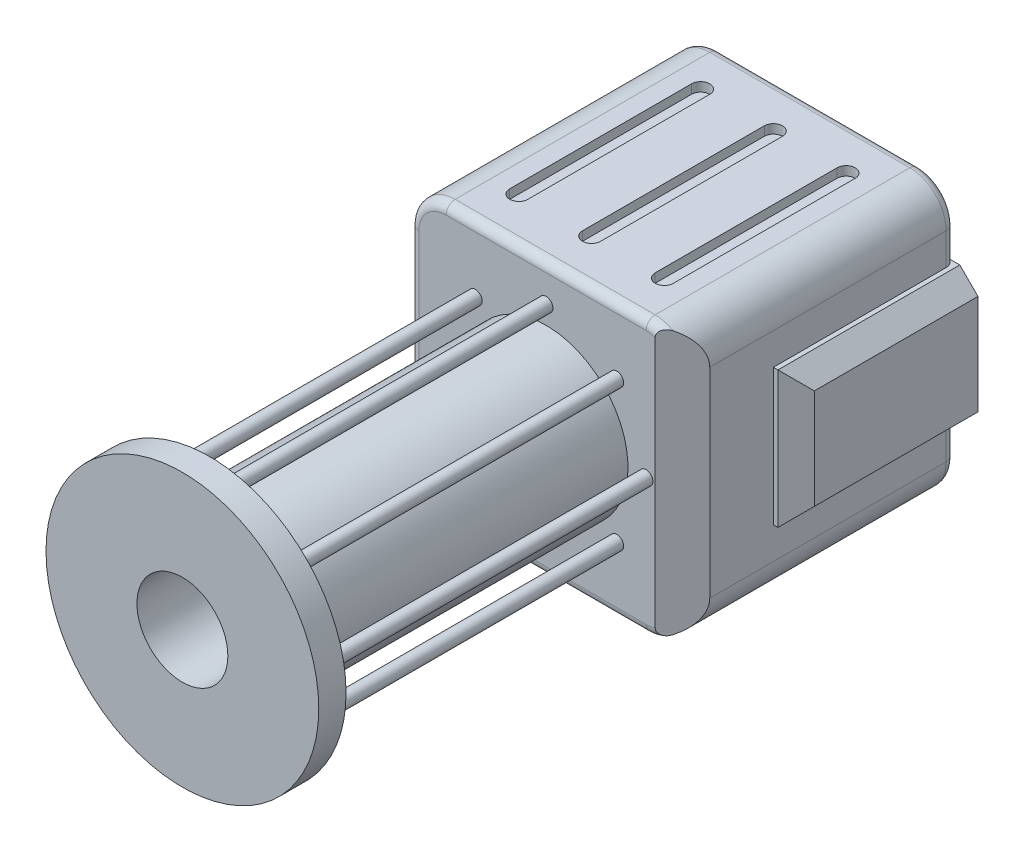
from build123d import *

# Parameters (mm, degrees)
SKETCH1_W           = 30
SKETCH1_H           = 30
BOSS_EXTRUDE1_DEPTH = 15
FILLET1_R           = 4
CHAMFER2_SIZE       = 3
FILLET2_R           = 1
SKETCH3_R           = 10
BOSS_EXTRUDE2_DEPTH = 5
FILLET3_R           = 5
SKETCH4_W           = 5
SKETCH4_H           = 15
BOSS_EXTRUDE3_DEPTH = 20
CHAMFER3_SIZE       = 2
SKETCH5_R           = 5
CUT_EXTRUDE1_DEPTH  = 10
SKETCH6_R           = 0.75
BOSS_EXTRUDE5_DEPTH = 40
CIRPATTERN2_COUNT   = 8
SKETCH7_R           = 5
CUT_EXTRUDE2_DEPTH  = 10
CUT_EXTRUDE3_DEPTH  = 1
LPATTERN1_COUNT     = 2
LPATTERN1_PITCH     = 8
LPATTERN1_COL_COUNT = 2
LPATTERN1_COL_PITCH = 8


# Some blends are built 0.0001 mm under size
with BuildPart() as part:
    # Sketch1 → Boss-Extrude1 (new, symmetric)
    with BuildSketch(Plane.XY):
        Rectangle(SKETCH1_W, SKETCH1_H)
    extrude(amount=BOSS_EXTRUDE1_DEPTH, both=True)

    # Sketch2 → Revolve1 (revolve)
    with BuildSketch(Plane(origin=(0, 0, 0), x_dir=(0, 0, -1), z_dir=(1, 0, 0)), mode=Mode.PRIVATE) as revolve1_sk:
        Polygon((-55, 0), (-55, 15), (-52, 15), (-52, 9), (-15, 9), (-15, 0), align=None)
    revolve(revolve1_sk.sketch.rotate(Axis((0, 0, 15), (0, 0, 1)), 90), axis=Axis((0, 0, 15), (0, 0, 1)))

    # Fillet1
    fillet1_edges = [part.edges().sort_by_distance(p)[0] for p in [
        (15, -15, 0),
        (-15, -15, 0),
        (-15, 15, 0),
        (15, 15, 0),
    ]]
    fillet(fillet1_edges, radius=FILLET1_R)

    # Chamfer2
    # the kernel refuses this chamfer: 3 mm, written as the material it takes off along each edge
    with BuildSketch(Plane(origin=(15, 18.715048964, 15), x_dir=(-0.9996219169112969, 0, 0.02749587661058621), z_dir=(0, -1, 0))) as chamfer2_piece_1:
        Polygon((CHAMFER2_SIZE * 0.999621916911, CHAMFER2_SIZE * 0.0274958766106), (-CHAMFER2_SIZE * 0.0274958766106, CHAMFER2_SIZE * 0.999621916911), (0, 0), align=None)
    extrude(amount=37.430097928, mode=Mode.SUBTRACT)

    # Fillet2
    fillet2_edges = [part.edges().sort_by_distance(p)[0] for p in [
        (13.828427125, 13.828427125, -15),
        (15, 0, -15),
        (13.828427125, -13.828427125, -15),
        (0, -15, -15),
        (-13.828427125, -13.828427125, -15),
        (-15, 0, -15),
        (-13.828427125, 13.828427125, -15),
        (11.50401717, 14.968118785, 15),
        (11.50401717, -14.968118785, 15),
        (0, -15, 15),
        (-13.828427125, -13.828427125, 15),
        (-15, 0, 15),
        (-13.828427125, 13.828427125, 15),
        (0, 15, -15),
        (0, 15, 15),
    ]]
    fillet(fillet2_edges, radius=FILLET2_R)

    # Sketch3 → Boss-Extrude2 (add)
    with BuildSketch(Plane(origin=(0, 0, -15), x_dir=(-1, 0, 0), z_dir=(0, 0, -1))):
        with Locations(Location((0, 0, 0), (0, 0, 180))):
            Circle(SKETCH3_R)
    extrude(amount=BOSS_EXTRUDE2_DEPTH)

    # Fillet3
    fillet3_edges = [part.edges().sort_by_distance(p)[0] for p in [
        (-10, 0, -20),
    ]]
    fillet(fillet3_edges, radius=FILLET3_R - 0.0001)  # a hair under: the kernel refuses the full size

    # Sketch4 → Boss-Extrude3 (add)
    with BuildSketch(Plane(origin=(0, 0, -15), x_dir=(-1, 0, 0), z_dir=(0, 0, -1))):
        with Locations((-15, 0)):
            Rectangle(SKETCH4_W, SKETCH4_H)
    extrude(amount=-BOSS_EXTRUDE3_DEPTH)

    # Chamfer3
    chamfer3_edges = [part.edges().sort_by_distance(p)[0] for p in [
        (17.5, 7.5, -5),
        (17.5, 0, 5),
        (17.5, -7.5, -5),
    ]]
    chamfer(chamfer3_edges, length=CHAMFER3_SIZE)

    # Sketch5 → Cut-Extrude1 (cut)
    with BuildSketch(Plane.XY.offset(55)):
        Circle(SKETCH5_R)
    extrude(amount=-CUT_EXTRUDE1_DEPTH, mode=Mode.SUBTRACT)

    # Sketch6 → Boss-Extrude5 (add)
    with BuildSketch(Plane.XY.offset(55)):
        with Locations((0, 11)):
            Circle(SKETCH6_R)
    boss_extrude5 = extrude(amount=-BOSS_EXTRUDE5_DEPTH)

    # CirPattern2: Boss-Extrude5 ×8 about axis
    cirpattern2_axis = Axis((0, 0, 0), (0, 0, 1))
    for i in range(1, CIRPATTERN2_COUNT):
        add(boss_extrude5.rotate(cirpattern2_axis, i * 360 / CIRPATTERN2_COUNT))

    # Sketch7 → Cut-Extrude2 (cut)
    with BuildSketch(Plane.ZY.offset(15)):
        with Locations(Location((0, 0, 0), (0, 0, 270))):
            Circle(SKETCH7_R)
    extrude(amount=-CUT_EXTRUDE2_DEPTH, mode=Mode.SUBTRACT)

    # Sketch8 → Cut-Extrude3 (cut)
    with BuildSketch(Plane(origin=(0, 15, 0), x_dir=(1, 0, 0), z_dir=(0, 1, 0))):
        with BuildLine():
            Line((-1, -10), (-1, 10))
            ThreePointArc((-1, 10), (0, 11), (1, 10))
            Line((1, 10), (1, -10))
            ThreePointArc((1, -10), (0, -11), (-1, -10))
        make_face()
    cut_extrude3 = extrude(amount=-CUT_EXTRUDE3_DEPTH, mode=Mode.SUBTRACT)

    # LPattern1: Cut-Extrude3 ×2
    with Locations(*[(-i * LPATTERN1_PITCH, 0, 0) for i in range(1, LPATTERN1_COUNT)]):
        add(cut_extrude3, mode=Mode.SUBTRACT)

    # LPattern1 col: Cut-Extrude3 ×2
    with Locations(*[(i * LPATTERN1_COL_PITCH, 0, 0) for i in range(1, LPATTERN1_COL_COUNT)]):
        add(cut_extrude3, mode=Mode.SUBTRACT)


solid = part.part
